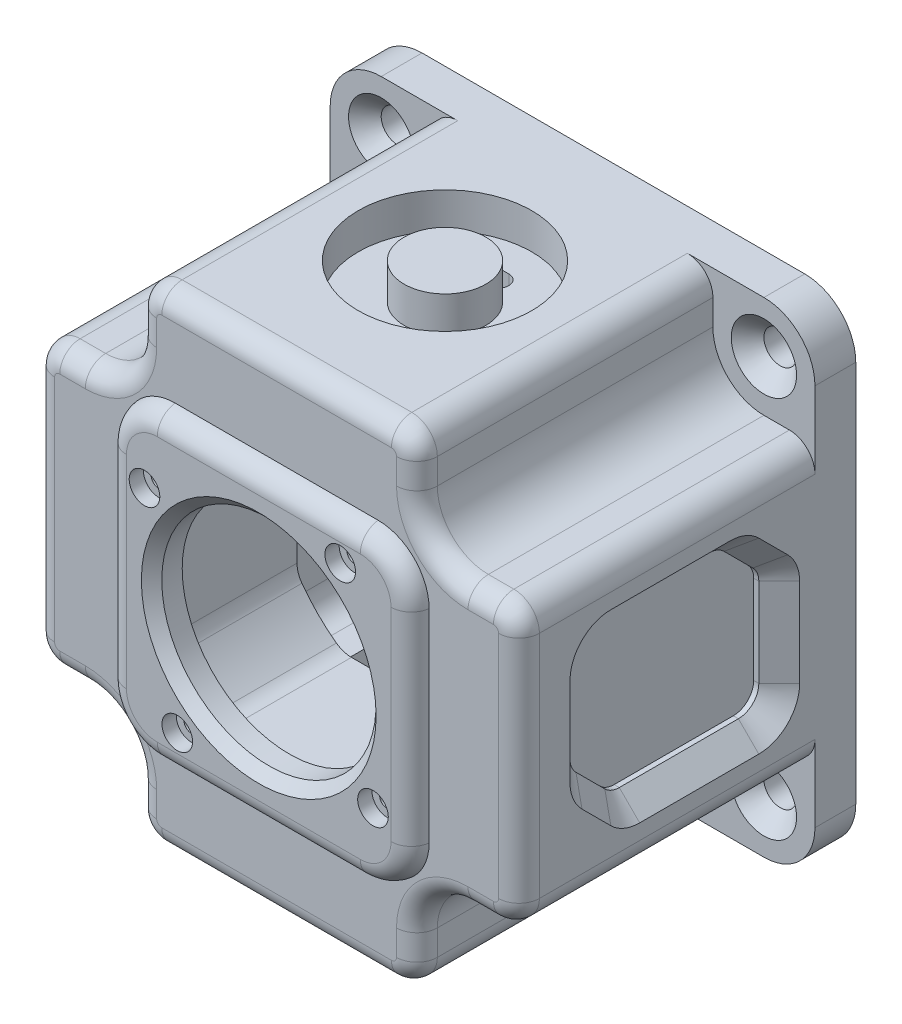
from build123d import *

# Parameters (mm, degrees)
SKETCH_1_R                = 3
EXTRUDE_1_DEPTH           = 60
EXTRUDE_START             = 3
SKETCH_2_R                = 1.5
SKETCH_2_R_2              = 3
EXTRUDE_2_DEPTH           = 3
EXTRUDE_3_DEPTH           = 3
SKETCH_4_R                = 1.5
CUT_EXTRUDE_1_DEPTH       = 91.069417673
SKETCH_6_OUTSIDE_W        = 126.938
SKETCH_6_OUTSIDE_H        = 126.938
CUT_EXTRUDE_2_DEPTH       = 58
EXTRUDE_START_2           = 3.5
SKETCH_9_R                = 1.5
EXTRUDE_4_DEPTH           = 3.5
FILLET_1_R                = 4
SKETCH_7_R                = 21
CUT_EXTRUDE_3_DEPTH       = 97.657901902
SKETCH_8_R                = 3
CUT_EXTRUDE_4_DEPTH       = 2.8
FILLET_2_R                = 4
CUT_EXTRUDE_5_DEPTH       = 5
CHAMFER_1_SIZE            = 4
CHAMFER_2_SIZE            = 2
CUT_EXTRUDE_START         = -5
CUT_EXTRUDE_6_DEPTH       = 5
CHAMFER_3_SIZE            = 4
SKETCH_12_R               = 17
SKETCH_12_R_2             = 8
CUT_EXTRUDE_7_DEPTH       = 7
CUT_EXTRUDE_8_DEPTH       = 23
HOLE_WIZARD_1_D           = 6.4
HOLE_WIZARD_1_DEPTH       = 8.1
HOLE_WIZARD_1_CSINK_D     = 12.8
HOLE_WIZARD_1_CSINK_ANGLE = 90
HOLE_WIZARD_1_TIP         = 1.922753981
CUT_EXTRUDE_9_DEPTH       = 17.5
CUT_EXTRUDE_10_DEPTH      = 36
CUT_EXTRUDE_START_2       = -3.5
SKETCH_19_R               = 1.5
CUT_EXTRUDE_11_DEPTH      = 3.5
CUT_EXTRUDE_12_DEPTH      = 36
FILLET_3_R                = 2


with BuildPart() as part:
    # 草图1 → 凸台-拉伸1 (new body)
    with BuildSketch(Plane.XY):
        with BuildLine():
            Line((-37.5, 47.5), (37.5, 47.5))
            ThreePointArc((37.5, 47.5), (44.571067812, 44.571067812), (47.5, 37.5))
            Line((47.5, 37.5), (47.5, -37.5))
            ThreePointArc((47.5, -37.5), (44.571067812, -44.571067812), (37.5, -47.5))
            Line((37.5, -47.5), (-37.5, -47.5))
            ThreePointArc((-37.5, -47.5), (-44.571067812, -44.571067812), (-47.5, -37.5))
            Line((-47.5, -37.5), (-47.5, 37.5))
            ThreePointArc((-47.5, 37.5), (-44.571067812, 44.571067812), (-37.5, 47.5))
        make_face()
        with Locations((-37.5, 37.5)):
            Circle(SKETCH_1_R, mode=Mode.SUBTRACT)
        with Locations((37.5, 37.5)):
            Circle(SKETCH_1_R, mode=Mode.SUBTRACT)
        with Locations((37.5, -37.5)):
            Circle(SKETCH_1_R, mode=Mode.SUBTRACT)
        with Locations((-37.5, -37.5)):
            Circle(SKETCH_1_R, mode=Mode.SUBTRACT)
        with BuildLine():
            Line((26, 15.329709717), (26, -15.329709717))
            ThreePointArc((26, -15.329709717), (25.75354119, -16.880143899), (25.038461538, -18.277730816))
            ThreePointArc((25.038461538, -18.277730816), (21.920310217, -21.920310217), (18.277730816, -25.038461538))
            ThreePointArc((18.277730816, -25.038461538), (16.880143899, -25.75354119), (15.329709717, -26))
            Line((15.329709717, -26), (-15.329709717, -26))
            ThreePointArc((-15.329709717, -26), (-16.880143899, -25.75354119), (-18.277730816, -25.038461538))
            ThreePointArc((-18.277730816, -25.038461538), (-21.920310217, -21.920310217), (-25.038461538, -18.277730816))
            ThreePointArc((-25.038461538, -18.277730816), (-25.75354119, -16.880143899), (-26, -15.329709717))
            Line((-26, -15.329709717), (-26, 15.329709717))
            ThreePointArc((-26, 15.329709717), (-25.75354119, 16.880143899), (-25.038461538, 18.277730816))
            ThreePointArc((-25.038461538, 18.277730816), (-21.920310217, 21.920310217), (-18.277730816, 25.038461538))
            ThreePointArc((-18.277730816, 25.038461538), (-16.880143899, 25.75354119), (-15.329709717, 26))
            Line((-15.329709717, 26), (15.329709717, 26))
            ThreePointArc((15.329709717, 26), (16.880143899, 25.75354119), (18.277730816, 25.038461538))
            ThreePointArc((18.277730816, 25.038461538), (21.920310217, 21.920310217), (25.038461538, 18.277730816))
            ThreePointArc((25.038461538, 18.277730816), (25.75354119, 16.880143899), (26, 15.329709717))
        make_face(mode=Mode.SUBTRACT)
    extrude(amount=-EXTRUDE_1_DEPTH)

    # 草图2 → 凸台-拉伸2 (add)
    with BuildSketch(Plane.XY.offset(EXTRUDE_START)):
        with BuildLine():
            Line((37.5, -47.5), (-37.5, -47.5))
            ThreePointArc((-37.5, -47.5), (-44.571067812, -44.571067812), (-47.5, -37.5))
            Line((-47.5, -37.5), (-47.5, 37.5))
            ThreePointArc((-47.5, 37.5), (-44.571067812, 44.571067812), (-37.5, 47.5))
            Line((-37.5, 47.5), (37.5, 47.5))
            ThreePointArc((37.5, 47.5), (44.571067812, 44.571067812), (47.5, 37.5))
            Line((47.5, 37.5), (47.5, -37.5))
            ThreePointArc((47.5, -37.5), (44.571067812, -44.571067812), (37.5, -47.5))
        make_face()
        with Locations((-15.969331282, -22.388176755)):
            Circle(SKETCH_2_R, mode=Mode.SUBTRACT)
        with Locations((22.388176755, -15.969331282)):
            Circle(SKETCH_2_R, mode=Mode.SUBTRACT)
        with Locations((15.969331282, 22.388176755)):
            Circle(SKETCH_2_R, mode=Mode.SUBTRACT)
        with Locations((-22.388176755, 15.969331282)):
            Circle(SKETCH_2_R, mode=Mode.SUBTRACT)
        with Locations((-37.5, 37.5)):
            Circle(SKETCH_2_R_2, mode=Mode.SUBTRACT)
        with Locations((37.5, 37.5)):
            Circle(SKETCH_2_R_2, mode=Mode.SUBTRACT)
        with Locations((37.5, -37.5)):
            Circle(SKETCH_2_R_2, mode=Mode.SUBTRACT)
        with Locations((-37.5, -37.5)):
            Circle(SKETCH_2_R_2, mode=Mode.SUBTRACT)
    extrude(amount=-EXTRUDE_2_DEPTH)

    # 草图3 → 凸台-拉伸3 (add)
    with BuildSketch(Plane.XY.offset(3).offset(EXTRUDE_START)):
        with BuildLine():
            Line((27.5, -42.5), (27.5, -37.5))
            ThreePointArc((27.5, -37.5), (30.428932188, -30.428932188), (37.5, -27.5))
            Line((37.5, -27.5), (42.5, -27.5))
            ThreePointArc((42.5, -27.5), (46.035533906, -26.035533906), (47.5, -22.5))
            Line((47.5, -22.5), (47.5, 22.5))
            ThreePointArc((47.5, 22.5), (46.035533906, 26.035533906), (42.5, 27.5))
            Line((42.5, 27.5), (37.5, 27.5))
            ThreePointArc((37.5, 27.5), (30.428932188, 30.428932188), (27.5, 37.5))
            Line((27.5, 37.5), (27.5, 42.5))
            ThreePointArc((27.5, 42.5), (26.035533906, 46.035533906), (22.5, 47.5))
            Line((22.5, 47.5), (-22.5, 47.5))
            ThreePointArc((-22.5, 47.5), (-26.035533906, 46.035533906), (-27.5, 42.5))
            Line((-27.5, 42.5), (-27.5, 37.5))
            ThreePointArc((-27.5, 37.5), (-30.428932188, 30.428932188), (-37.5, 27.5))
            Line((-37.5, 27.5), (-42.5, 27.5))
            ThreePointArc((-42.5, 27.5), (-46.035533906, 26.035533906), (-47.5, 22.5))
            Line((-47.5, 22.5), (-47.5, -22.5))
            ThreePointArc((-47.5, -22.5), (-46.035533906, -26.035533906), (-42.5, -27.5))
            Line((-42.5, -27.5), (-37.5, -27.5))
            ThreePointArc((-37.5, -27.5), (-30.428932188, -30.428932188), (-27.5, -37.5))
            Line((-27.5, -37.5), (-27.5, -42.5))
            ThreePointArc((-27.5, -42.5), (-26.035533906, -46.035533906), (-22.5, -47.5))
            Line((-22.5, -47.5), (22.5, -47.5))
            ThreePointArc((22.5, -47.5), (26.035533906, -46.035533906), (27.5, -42.5))
        make_face()
    extrude(amount=-EXTRUDE_3_DEPTH)

    # 草图4 → 切除-拉伸1 (cut, through all)
    with BuildSketch(Plane(origin=(0, 0, 0), x_dir=(-1, 0, 0), z_dir=(0, 0, -1))):
        with Locations((15.969331282, -22.388176755)):
            Circle(SKETCH_4_R)
        with Locations((22.388176755, 15.969331282)):
            Circle(SKETCH_4_R)
        with Locations((-15.969331282, 22.388176755)):
            Circle(SKETCH_4_R)
        with Locations((-22.388176755, -15.969331282)):
            Circle(SKETCH_4_R)
    extrude(amount=-CUT_EXTRUDE_1_DEPTH, mode=Mode.SUBTRACT)

    # 草图6 outside → 切除-拉伸2 (cut)
    with BuildSketch(Plane.XY.offset(6)):
        Rectangle(SKETCH_6_OUTSIDE_W, SKETCH_6_OUTSIDE_H)
        with BuildLine():
            Line((37.5, -27.5), (42.5, -27.5))
            ThreePointArc((42.5, -27.5), (46.035533906, -26.035533906), (47.5, -22.5))
            Line((47.5, -22.5), (47.5, 22.5))
            ThreePointArc((47.5, 22.5), (46.035533906, 26.035533906), (42.5, 27.5))
            Line((42.5, 27.5), (37.5, 27.5))
            ThreePointArc((37.5, 27.5), (30.428932188, 30.428932188), (27.5, 37.5))
            Line((27.5, 37.5), (27.5, 42.5))
            ThreePointArc((27.5, 42.5), (26.035533906, 46.035533906), (22.5, 47.5))
            Line((22.5, 47.5), (-22.5, 47.5))
            ThreePointArc((-22.5, 47.5), (-26.035533906, 46.035533906), (-27.5, 42.5))
            Line((-27.5, 42.5), (-27.5, 37.5))
            ThreePointArc((-27.5, 37.5), (-30.428932188, 30.428932188), (-37.5, 27.5))
            Line((-37.5, 27.5), (-42.5, 27.5))
            ThreePointArc((-42.5, 27.5), (-46.035533906, 26.035533906), (-47.5, 22.5))
            Line((-47.5, 22.5), (-47.5, -22.5))
            ThreePointArc((-47.5, -22.5), (-46.035533906, -26.035533906), (-42.5, -27.5))
            Line((-42.5, -27.5), (-37.5, -27.5))
            ThreePointArc((-37.5, -27.5), (-30.428932188, -30.428932188), (-27.5, -37.5))
            Line((-27.5, -37.5), (-27.5, -42.5))
            ThreePointArc((-27.5, -42.5), (-26.035533906, -46.035533906), (-22.5, -47.5))
            Line((-22.5, -47.5), (22.5, -47.5))
            ThreePointArc((22.5, -47.5), (26.035533906, -46.035533906), (27.5, -42.5))
            Line((27.5, -42.5), (27.5, -37.5))
            ThreePointArc((27.5, -37.5), (30.428932188, -30.428932188), (37.5, -27.5))
        make_face(mode=Mode.SUBTRACT)
    extrude(amount=-CUT_EXTRUDE_2_DEPTH, mode=Mode.SUBTRACT)

    # 草图9 → 凸台-拉伸4 (add)
    with BuildSketch(Plane.XY.offset(6).offset(EXTRUDE_START_2)):
        with BuildLine():
            Line((-19.888176755, -29.888176755), (19.888176755, -29.888176755))
            ThreePointArc((19.888176755, -29.888176755), (26.959244567, -26.959244567), (29.888176755, -19.888176755))
            Line((29.888176755, -19.888176755), (29.888176755, 19.888176755))
            ThreePointArc((29.888176755, 19.888176755), (26.959244567, 26.959244567), (19.888176755, 29.888176755))
            Line((19.888176755, 29.888176755), (-19.888176755, 29.888176755))
            ThreePointArc((-19.888176755, 29.888176755), (-26.959244567, 26.959244567), (-29.888176755, 19.888176755))
            Line((-29.888176755, 19.888176755), (-29.888176755, -19.888176755))
            ThreePointArc((-29.888176755, -19.888176755), (-26.959244567, -26.959244567), (-19.888176755, -29.888176755))
        make_face()
        with Locations((-22.388176755, 15.969331282)):
            Circle(SKETCH_9_R, mode=Mode.SUBTRACT)
        with Locations((15.969331282, 22.388176755)):
            Circle(SKETCH_9_R, mode=Mode.SUBTRACT)
        with Locations((22.388176755, -15.969331282)):
            Circle(SKETCH_9_R, mode=Mode.SUBTRACT)
        with Locations((-15.969331282, -22.388176755)):
            Circle(SKETCH_9_R, mode=Mode.SUBTRACT)
    extrude(amount=-EXTRUDE_4_DEPTH)

    # 圆角1
    # the kernel refuses this fillet: 4 mm, written as the material it takes off along each edge
    with BuildSketch(Plane(origin=(-19.888176755, 19.888176755, 9.5), x_dir=(0, 1, 0), z_dir=(1, 0, 0))) as fillet_1_piece_1:
        with BuildLine():
            CenterArc((6.031373033, -4), FILLET_1_R, 7.180755781, 82.819244219)
            Line((6.031373033, 0), (6.031373033, 0.08))
            Line((6.031373033, 0.08), (10, 0.08))
            Line((10, 0.08), (10.08, 0))
            ThreePointArc((10.08, 0), (10.08, -1.75), (10.079372539, -3.49))
            Line((10.079372539, -3.49), (10, -3.5))
        make_face()
    revolve(axis=Axis((-19.888176755, 19.888176755, 9.5), (0, 0, 1)), revolution_arc=90, mode=Mode.SUBTRACT)
    with BuildSketch(Plane(origin=(19.888176755, 29.888176755, 9.5), x_dir=(0, 0, -1), z_dir=(-1, 0, 0)), Plane(origin=(29.888176755, -19.888176755, 9.5), x_dir=(0, 0, -1), z_dir=(0, 1, 0)), Plane(origin=(-19.888176755, -29.888176755, 9.5), x_dir=(0, 0, -1), z_dir=(1, 0, 0)), Plane(origin=(-29.888176755, 19.888176755, 9.5), x_dir=(0, 0, -1), z_dir=(0, -1, 0))) as fillet_1_piece_2:
        with BuildLine():
            CenterArc((4, 3.968626967), FILLET_1_R, 180, 82.819244219)
            Line((0, 3.968626967), (-0.08, 3.968626967))
            Line((-0.08, 3.968626967), (-0.08, 0))
            Line((-0.08, 0), (0, -0.08))
            ThreePointArc((0, -0.08), (1.75, -0.08), (3.49, -0.079372539))
            Line((3.49, -0.079372539), (3.5, 0))
        make_face()
    extrude(amount=39.77635351, mode=Mode.SUBTRACT)
    with BuildSketch(Plane(origin=(19.888176755, 19.888176755, 9.5), x_dir=(1, 0, 0), z_dir=(0, -1, 0))) as fillet_1_piece_3:
        with BuildLine():
            CenterArc((6.031373033, -4), FILLET_1_R, 7.180755781, 82.819244219)
            Line((6.031373033, 0), (6.031373033, 0.08))
            Line((6.031373033, 0.08), (10, 0.08))
            Line((10, 0.08), (10.08, 0))
            ThreePointArc((10.08, 0), (10.08, -1.75), (10.079372539, -3.49))
            Line((10.079372539, -3.49), (10, -3.5))
        make_face()
    revolve(axis=Axis((19.888176755, 19.888176755, 9.5), (0, 0, 1)), revolution_arc=90, mode=Mode.SUBTRACT)
    with BuildSketch(Plane(origin=(19.888176755, -19.888176755, 9.5), x_dir=(0, -1, 0), z_dir=(-1, 0, 0))) as fillet_1_piece_4:
        with BuildLine():
            CenterArc((6.031373033, -4), FILLET_1_R, 7.180755781, 82.819244219)
            Line((6.031373033, 0), (6.031373033, 0.08))
            Line((6.031373033, 0.08), (10, 0.08))
            Line((10, 0.08), (10.08, 0))
            ThreePointArc((10.08, 0), (10.08, -1.75), (10.079372539, -3.49))
            Line((10.079372539, -3.49), (10, -3.5))
        make_face()
    revolve(axis=Axis((19.888176755, -19.888176755, 9.5), (0, 0, 1)), revolution_arc=90, mode=Mode.SUBTRACT)
    with BuildSketch(Plane(origin=(-19.888176755, -19.888176755, 9.5), x_dir=(-1, 0, 0), z_dir=(0, 1, 0))) as fillet_1_piece_5:
        with BuildLine():
            CenterArc((6.031373033, -4), FILLET_1_R, 7.180755781, 82.819244219)
            Line((6.031373033, 0), (6.031373033, 0.08))
            Line((6.031373033, 0.08), (10, 0.08))
            Line((10, 0.08), (10.08, 0))
            ThreePointArc((10.08, 0), (10.08, -1.75), (10.079372539, -3.49))
            Line((10.079372539, -3.49), (10, -3.5))
        make_face()
    revolve(axis=Axis((-19.888176755, -19.888176755, 9.5), (0, 0, 1)), revolution_arc=90, mode=Mode.SUBTRACT)

    # 草图7 → 切除-拉伸3 (cut, through all)
    with BuildSketch(Plane.XY.offset(9.5)):
        Circle(SKETCH_7_R)
    extrude(amount=-CUT_EXTRUDE_3_DEPTH, mode=Mode.SUBTRACT)

    # 草图8 → 切除-拉伸4 (cut)
    with BuildSketch(Plane.XY.offset(9.5)):
        with Locations((-15.969331282, -22.388176755)):
            Circle(SKETCH_8_R)
        with Locations((-22.388176755, 15.969331282)):
            Circle(SKETCH_8_R)
        with Locations((15.969331282, 22.388176755)):
            Circle(SKETCH_8_R)
        with Locations((22.388176755, -15.969331282)):
            Circle(SKETCH_8_R)
    extrude(amount=-CUT_EXTRUDE_4_DEPTH, mode=Mode.SUBTRACT)

    # 圆角2
    fillet_2_edges = [part.edges().sort_by_distance(p)[0] for p in [
        (30.428932188, -30.428932188, 6),
        (40, -27.5, 6),
        (46.035533906, -26.035533906, 6),
        (47.5, 0, 6),
        (46.035533906, 26.035533906, 6),
        (40, 27.5, 6),
        (30.428932188, 30.428932188, 6),
        (27.5, 40, 6),
        (26.035533906, 46.035533906, 6),
        (0, 47.5, 6),
        (-26.035533906, 46.035533906, 6),
        (-27.5, 40, 6),
        (-30.428932188, 30.428932188, 6),
        (-40, 27.5, 6),
        (-46.035533906, 26.035533906, 6),
        (-47.5, 0, 6),
        (-46.035533906, -26.035533906, 6),
        (-40, -27.5, 6),
        (-30.428932188, -30.428932188, 6),
        (-27.5, -40, 6),
        (-26.035533906, -46.035533906, 6),
        (0, -47.5, 6),
        (26.035533906, -46.035533906, 6),
        (27.5, -40, 6),
    ]]
    fillet(fillet_2_edges, radius=FILLET_2_R)

    # 草图10 → 切除-拉伸5 (cut)
    with BuildSketch(Plane(origin=(47.5, 0, 0), x_dir=(0, 0, -1), z_dir=(1, 0, 0))):
        with BuildLine():
            Line((17.656854249, -15.5), (41, -15.5))
            ThreePointArc((41, -15.5), (43.828427125, -14.328427125), (45, -11.5))
            Line((45, -11.5), (45, 5.843145751))
            ThreePointArc((45, 5.843145751), (44.69551813, 7.37387948), (43.828427125, 8.671572875))
            Line((43.828427125, 8.671572875), (38.171572875, 14.328427125))
            ThreePointArc((38.171572875, 14.328427125), (36.87387948, 15.19551813), (35.343145751, 15.5))
            Line((35.343145751, 15.5), (12, 15.5))
            ThreePointArc((12, 15.5), (9.171572875, 14.328427125), (8, 11.5))
            Line((8, 11.5), (8, -5.843145751))
            ThreePointArc((8, -5.843145751), (8.30448187, -7.37387948), (9.171572875, -8.671572875))
            Line((9.171572875, -8.671572875), (14.828427125, -14.328427125))
            ThreePointArc((14.828427125, -14.328427125), (16.12612052, -15.19551813), (17.656854249, -15.5))
        make_face()
    extrude(amount=-CUT_EXTRUDE_5_DEPTH, mode=Mode.SUBTRACT)

    # 倒角1
    chamfer_1_edges = [part.edges().sort_by_distance(p)[0] for p in [
        (47.5, -14.328427125, -43.828427125),
        (47.5, -2.828427125, -45),
        (47.5, 7.37387948, -44.69551813),
        (47.5, 11.5, -41),
        (47.5, 15.19551813, -36.87387948),
        (47.5, 15.5, -23.671572875),
        (47.5, 14.328427125, -9.171572875),
        (47.5, 2.828427125, -8),
        (47.5, -7.37387948, -8.30448187),
        (47.5, -11.5, -12),
        (47.5, -15.19551813, -16.12612052),
        (47.5, -15.5, -29.328427125),
    ]]
    chamfer(chamfer_1_edges, length=CHAMFER_1_SIZE)

    # 倒角2
    chamfer_2_edges = [part.edges().sort_by_distance(p)[0] for p in [
        (-21, 0, 9.5),
    ]]
    chamfer(chamfer_2_edges, length=CHAMFER_2_SIZE)

    # 草图11 → 切除-拉伸6 (cut)
    with BuildSketch(Plane.ZY.offset(47.5).offset(CUT_EXTRUDE_START)):
        with BuildLine():
            Line((-9.171572875, -8.671572875), (-14.828427125, -14.328427125))
            ThreePointArc((-14.828427125, -14.328427125), (-16.12612052, -15.19551813), (-17.656854249, -15.5))
            Line((-17.656854249, -15.5), (-41, -15.5))
            ThreePointArc((-41, -15.5), (-43.828427125, -14.328427125), (-45, -11.5))
            Line((-45, -11.5), (-45, 5.843145751))
            ThreePointArc((-45, 5.843145751), (-44.69551813, 7.37387948), (-43.828427125, 8.671572875))
            Line((-43.828427125, 8.671572875), (-38.171572875, 14.328427125))
            ThreePointArc((-38.171572875, 14.328427125), (-36.87387948, 15.19551813), (-35.343145751, 15.5))
            Line((-35.343145751, 15.5), (-12, 15.5))
            ThreePointArc((-12, 15.5), (-9.171572875, 14.328427125), (-8, 11.5))
            Line((-8, 11.5), (-8, -5.843145751))
            ThreePointArc((-8, -5.843145751), (-8.30448187, -7.37387948), (-9.171572875, -8.671572875))
        make_face()
    extrude(amount=CUT_EXTRUDE_6_DEPTH, mode=Mode.SUBTRACT)

    # 倒角3
    chamfer_3_edges = [part.edges().sort_by_distance(p)[0] for p in [
        (-47.5, -7.37387948, -8.30448187),
        (-47.5, 2.828427125, -8),
        (-47.5, 14.328427125, -9.171572875),
        (-47.5, 15.5, -23.671572875),
        (-47.5, 15.19551813, -36.87387948),
        (-47.5, 11.5, -41),
        (-47.5, 7.37387948, -44.69551813),
        (-47.5, -2.828427125, -45),
        (-47.5, -14.328427125, -43.828427125),
        (-47.5, -15.5, -29.328427125),
        (-47.5, -15.19551813, -16.12612052),
        (-47.5, -11.5, -12),
    ]]
    chamfer(chamfer_3_edges, length=CHAMFER_3_SIZE)

    # 草图12 → 切除-拉伸7 (cut)
    with BuildSketch(Plane(origin=(0, 47.5, 0), x_dir=(1, 0, 0), z_dir=(0, 1, 0))):
        with Locations(Location((0, 27, 0), (0, 0, 180))):
            Circle(SKETCH_12_R)
        with Locations(Location((0, 27, 0), (0, 0, 180))):
            Circle(SKETCH_12_R_2, mode=Mode.SUBTRACT)
    extrude(amount=-CUT_EXTRUDE_7_DEPTH, mode=Mode.SUBTRACT)

    # 草图13 → 切除-拉伸8 (cut)
    with BuildSketch(Plane(origin=(0, 40.5, 0), x_dir=(1, 0, 0), z_dir=(0, 1, 0))):
        with BuildLine():
            Line((1.5, 34), (-1.5, 34))
            ThreePointArc((-1.5, 34), (-3.5, 36), (-1.5, 38))
            Line((-1.5, 38), (1.5, 38))
            ThreePointArc((1.5, 38), (3.5, 36), (1.5, 34))
        make_face()
    extrude(amount=-CUT_EXTRUDE_8_DEPTH, mode=Mode.SUBTRACT)

    # 打孔尺寸(%根据)内六角花形半沉头螺钉的类型1
    with Locations(Plane.XY.offset(-52)):
        with Locations((-37.5, -37.5), (37.5, -37.5), (37.5, 37.5), (-37.5, 37.5)):
            CounterSinkHole(HOLE_WIZARD_1_D / 2, HOLE_WIZARD_1_CSINK_D / 2, depth=HOLE_WIZARD_1_DEPTH, counter_sink_angle=HOLE_WIZARD_1_CSINK_ANGLE)
            with Locations((0, 0, -(HOLE_WIZARD_1_DEPTH + HOLE_WIZARD_1_TIP / 2))):  # 118° drill point
                Cone(0, HOLE_WIZARD_1_D / 2, HOLE_WIZARD_1_TIP, mode=Mode.SUBTRACT)

    # 草图17 → 切除-拉伸9 (cut)
    with BuildSketch(Plane.XZ.offset(47.5)):
        with BuildLine():
            Line((-15.5, -4), (15.5, -4))
            ThreePointArc((15.5, -4), (18.328427125, -5.171572875), (19.5, -8))
            Line((19.5, -8), (19.5, -43))
            ThreePointArc((19.5, -43), (18.328427125, -45.828427125), (15.5, -47))
            Line((15.5, -47), (-15.5, -47))
            ThreePointArc((-15.5, -47), (-18.328427125, -45.828427125), (-19.5, -43))
            Line((-19.5, -43), (-19.5, -8))
            ThreePointArc((-19.5, -8), (-18.328427125, -5.171572875), (-15.5, -4))
        make_face()
    extrude(amount=-CUT_EXTRUDE_9_DEPTH, mode=Mode.SUBTRACT)

    # 草图18 → 切除-拉伸10 (cut)
    with BuildSketch(Plane(origin=(0, 0, -60), x_dir=(-1, 0, 0), z_dir=(0, 0, -1))):
        with BuildLine():
            Line((-25, 30), (25, 30))
            ThreePointArc((25, 30), (28.535533906, 28.535533906), (30, 25))
            Line((30, 25), (30, -25))
            ThreePointArc((30, -25), (28.535533906, -28.535533906), (25, -30))
            Line((25, -30), (-25, -30))
            ThreePointArc((-25, -30), (-28.535533906, -28.535533906), (-30, -25))
            Line((-30, -25), (-30, 25))
            ThreePointArc((-30, 25), (-28.535533906, 28.535533906), (-25, 30))
        make_face()
    extrude(amount=-CUT_EXTRUDE_10_DEPTH, mode=Mode.SUBTRACT)

    # 草图19 → 切除-拉伸11 (cut)
    with BuildSketch(Plane(origin=(0, 0, 0), x_dir=(-1, 0, 0), z_dir=(0, 0, -1)).offset(CUT_EXTRUDE_START_2)):
        with BuildLine():
            Line((-26, 15.329709717), (-26, -15.329709717))
            ThreePointArc((-26, -15.329709717), (-25.75354119, -16.880143899), (-25.038461538, -18.277730816))
            ThreePointArc((-25.038461538, -18.277730816), (-21.920310217, -21.920310217), (-18.277730816, -25.038461538))
            ThreePointArc((-18.277730816, -25.038461538), (-16.880143899, -25.75354119), (-15.329709717, -26))
            Line((-15.329709717, -26), (15.329709717, -26))
            ThreePointArc((15.329709717, -26), (16.880143899, -25.75354119), (18.277730816, -25.038461538))
            ThreePointArc((18.277730816, -25.038461538), (21.920310217, -21.920310217), (25.038461538, -18.277730816))
            ThreePointArc((25.038461538, -18.277730816), (25.75354119, -16.880143899), (26, -15.329709717))
            Line((26, -15.329709717), (26, 15.329709717))
            ThreePointArc((26, 15.329709717), (25.75354119, 16.880143899), (25.038461538, 18.277730816))
            ThreePointArc((25.038461538, 18.277730816), (21.920310217, 21.920310217), (18.277730816, 25.038461538))
            ThreePointArc((18.277730816, 25.038461538), (16.880143899, 25.75354119), (15.329709717, 26))
            Line((15.329709717, 26), (-15.329709717, 26))
            ThreePointArc((-15.329709717, 26), (-16.880143899, 25.75354119), (-18.277730816, 25.038461538))
            ThreePointArc((-18.277730816, 25.038461538), (-21.920310217, 21.920310217), (-25.038461538, 18.277730816))
            ThreePointArc((-25.038461538, 18.277730816), (-25.75354119, 16.880143899), (-26, 15.329709717))
        make_face()
        with Locations((-15.969331282, 22.388176755)):
            Circle(SKETCH_19_R, mode=Mode.SUBTRACT)
        with Locations((22.388176755, 15.969331282)):
            Circle(SKETCH_19_R, mode=Mode.SUBTRACT)
        with Locations((-22.388176755, -15.969331282)):
            Circle(SKETCH_19_R, mode=Mode.SUBTRACT)
        with Locations((15.969331282, -22.388176755)):
            Circle(SKETCH_19_R, mode=Mode.SUBTRACT)
    extrude(amount=CUT_EXTRUDE_11_DEPTH, mode=Mode.SUBTRACT)

    # 草图20 → 切除-拉伸12 (cut)
    with BuildSketch(Plane(origin=(0, 0, -60), x_dir=(-1, 0, 0), z_dir=(0, 0, -1))):
        with BuildLine():
            Line((33, 12), (-33, 12))
            ThreePointArc((-33, 12), (-34.414213562, 11.414213562), (-35, 10))
            Line((-35, 10), (-35, -10))
            ThreePointArc((-35, -10), (-34.414213562, -11.414213562), (-33, -12))
            Line((-33, -12), (33, -12))
            ThreePointArc((33, -12), (34.414213562, -11.414213562), (35, -10))
            Line((35, -10), (35, 10))
            ThreePointArc((35, 10), (34.414213562, 11.414213562), (33, 12))
        make_face()
    extrude(amount=-CUT_EXTRUDE_12_DEPTH, mode=Mode.SUBTRACT)

    # 圆角3
    fillet_3_edges = [part.edges().sort_by_distance(p)[0] for p in [
        (30, 12, -42),
        (30, -12, -42),
        (-30, -12, -42),
        (-30, 12, -42),
    ]]
    fillet(fillet_3_edges, radius=FILLET_3_R)


solid = part.part
